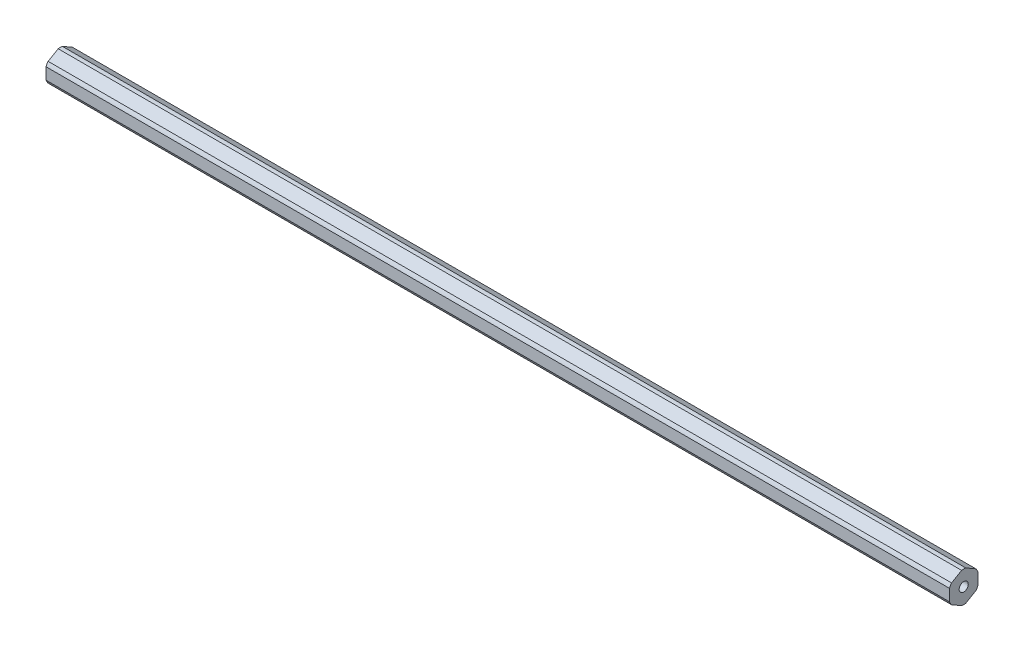
from build123d import *

# Parameters (mm, degrees)
BOSS_EXTRUDE1_DEPTH                  = 200.81875
F_10_32_TAPPED_HOLE1_D               = 4.0386
F_10_32_TAPPED_HOLE1_DEPTH           = 16.34744
F_10_32_TAPPED_HOLE1_TIP             = 1.213317848
F_10_32_TAPPED_HOLE1_ON_FACE_2_D     = 4.0386
F_10_32_TAPPED_HOLE1_ON_FACE_2_DEPTH = 16.34744
F_10_32_TAPPED_HOLE1_ON_FACE_2_TIP   = 1.213317848


with BuildPart() as part:
    # Sketch1 → Boss-Extrude1 (new, symmetric)
    with BuildSketch(Plane(origin=(0, 0, 0), x_dir=(0, 0, -1), z_dir=(1, 0, 0))):
        with BuildLine():
            ThreePointArc((0.93173274, 6.79441227), (0, 6.858), (-0.93173274, 6.79441227))
            Line((-0.93173274, 6.79441227), (-5.41826726, 4.204110358))
            ThreePointArc((-5.41826726, 4.204110358), (-5.939202219, 3.429), (-6.35, 2.590301913))
            Line((-6.35, 2.590301913), (-6.35, -2.590301913))
            ThreePointArc((-6.35, -2.590301913), (-5.939202219, -3.429), (-5.41826726, -4.204110358))
            Line((-5.41826726, -4.204110358), (-0.93173274, -6.79441227))
            ThreePointArc((-0.93173274, -6.79441227), (0, -6.858), (0.93173274, -6.79441227))
            Line((0.93173274, -6.79441227), (5.41826726, -4.204110358))
            ThreePointArc((5.41826726, -4.204110358), (5.939202219, -3.429), (6.35, -2.590301913))
            Line((6.35, -2.590301913), (6.35, 2.590301913))
            ThreePointArc((6.35, 2.590301913), (5.939202219, 3.429), (5.41826726, 4.204110358))
            Line((5.41826726, 4.204110358), (0.93173274, 6.79441227))
        make_face()
    extrude(amount=BOSS_EXTRUDE1_DEPTH, both=True)

    # #10-32 Tapped Hole1
    with Locations(Plane(origin=(-200.81875, 0, 0), x_dir=(0, 0, -1), z_dir=(-1, 0, 0))):
        with Locations((0, 0)):
            Hole(F_10_32_TAPPED_HOLE1_D / 2, depth=F_10_32_TAPPED_HOLE1_DEPTH)
            with Locations((0, 0, -(F_10_32_TAPPED_HOLE1_DEPTH + F_10_32_TAPPED_HOLE1_TIP / 2))):  # 118° drill point
                Cone(0, F_10_32_TAPPED_HOLE1_D / 2, F_10_32_TAPPED_HOLE1_TIP, mode=Mode.SUBTRACT)

    # #10-32 Tapped Hole1 on face 2
    with Locations(Plane(origin=(200.81875, 0, 0), x_dir=(0, 0, 1), z_dir=(1, 0, 0))):
        with Locations((0, 0)):
            Hole(F_10_32_TAPPED_HOLE1_ON_FACE_2_D / 2, depth=F_10_32_TAPPED_HOLE1_ON_FACE_2_DEPTH)
            with Locations((0, 0, -(F_10_32_TAPPED_HOLE1_ON_FACE_2_DEPTH + F_10_32_TAPPED_HOLE1_ON_FACE_2_TIP / 2))):  # 118° drill point
                Cone(0, F_10_32_TAPPED_HOLE1_ON_FACE_2_D / 2, F_10_32_TAPPED_HOLE1_ON_FACE_2_TIP, mode=Mode.SUBTRACT)


solid = part.part
